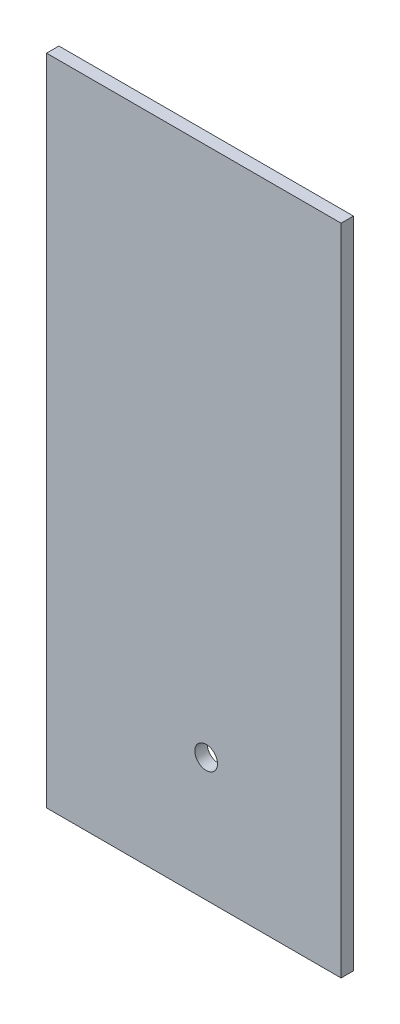
from build123d import *

# Parameters (mm, degrees)
SKETCH1_W           = 143
SKETCH1_H           = 317.37
BOSS_EXTRUDE1_DEPTH = 6
SKETCH2_R           = 5.5
CUT_EXTRUDE1_DEPTH  = 175.15274682


with BuildPart() as part:
    # Sketch1 → Boss-Extrude1 (new body)
    with BuildSketch(Plane.XY):
        Rectangle(SKETCH1_W, SKETCH1_H)
    extrude(amount=BOSS_EXTRUDE1_DEPTH)

    # Sketch2 → Cut-Extrude1 (cut, through all)
    with BuildSketch(Plane.XY.offset(6)):
        with Locations((6, -98.685)):
            Circle(SKETCH2_R)
    extrude(amount=-CUT_EXTRUDE1_DEPTH, mode=Mode.SUBTRACT)


solid = part.part
